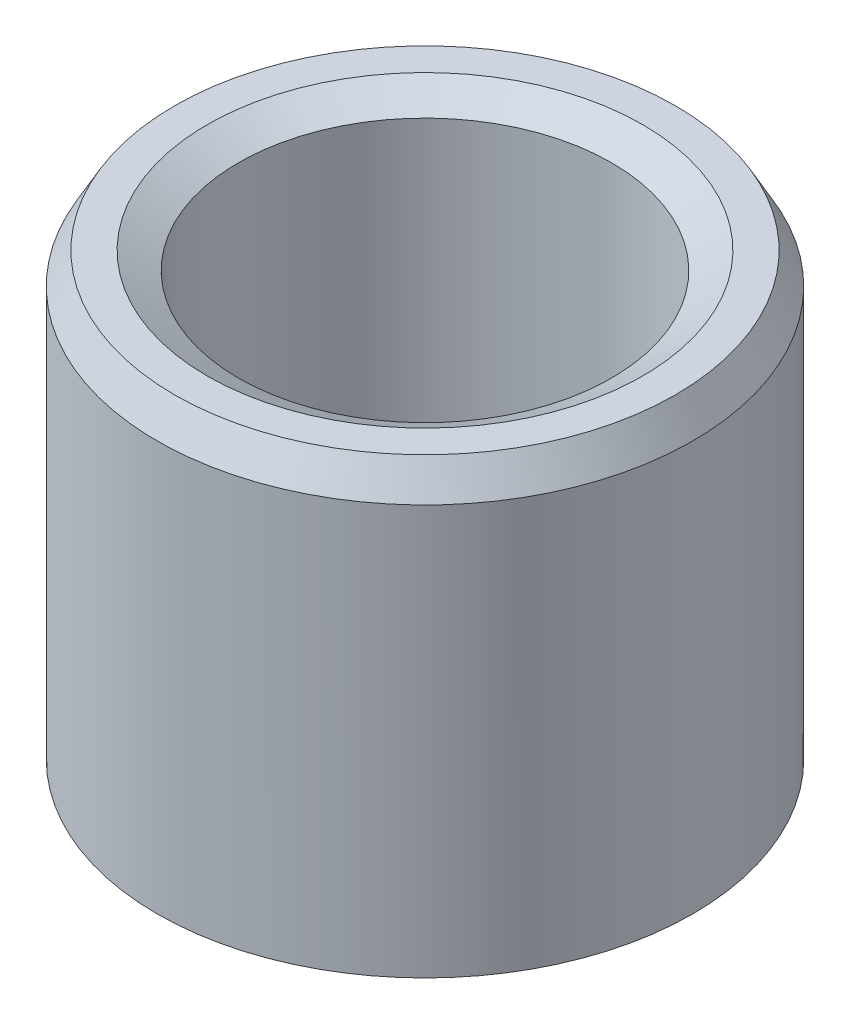
from build123d import *
from OCP.BRepFilletAPI import BRepFilletAPI_MakeChamfer

# Parameters (mm, degrees)
SKETCH1_R           = 27.5
BOSS_EXTRUDE1_DEPTH = 47.05147305
SKETCH2_R           = 19.156299915
CUT_EXTRUDE1_DEPTH  = 62.043763942
CHAMFER1_SIZE       = 3.201791099
CHAMFER1_SIZE2      = 1.786040665


with BuildPart() as part:
    # Sketch1 → Boss-Extrude1 (new body)
    with BuildSketch(Plane(origin=(0, 0, 0), x_dir=(1, 0, 0), z_dir=(0, 1, 0))):
        Circle(SKETCH1_R)
    extrude(amount=BOSS_EXTRUDE1_DEPTH)

    # Sketch2 → Cut-Extrude1 (cut, through all)
    with BuildSketch(Plane(origin=(0, 0, 0), x_dir=(1, 0, 0), z_dir=(0, 1, 0))):
        Circle(SKETCH2_R)
    extrude(amount=CUT_EXTRUDE1_DEPTH, mode=Mode.SUBTRACT)

    # Chamfer1: one chamfer whose edges measure the first distance from different faces: ONE call of the kernel's chamfer builder (chamfer() names one face for all edges)
    chamfer1_edges_1 = [part.edges().sort_by_distance(p)[0] for p in [
        (-19.156299915, 47.05147305, 0),
    ]]
    chamfer1_side_1 = [part.faces().sort_by_distance(p)[0] for p in [
        (-26.722182541, 47.05147305, 0),
    ]]
    chamfer1_edges_2 = [part.edges().sort_by_distance(p)[0] for p in [
        (-19.156299915, 0, 0),
    ]]
    chamfer1_side_2 = [part.faces().sort_by_distance(p)[0] for p in [
        (-19.156299915, 23.525736525, 0),
    ]]
    chamfer1_edges_3 = [part.edges().sort_by_distance(p)[0] for p in [
        (-27.5, 0, 0),
    ]]
    chamfer1_side_3 = [part.faces().sort_by_distance(p)[0] for p in [
        (-26.722182541, 0, 0),
    ]]
    chamfer1_edges_4 = [part.edges().sort_by_distance(p)[0] for p in [
        (-27.5, 47.05147305, 0),
    ]]
    chamfer1_side_4 = [part.faces().sort_by_distance(p)[0] for p in [
        (-27.5, 23.525736525, 0),
    ]]
    chamfer1 = BRepFilletAPI_MakeChamfer(part.part.solid().wrapped)
    for e in chamfer1_edges_1:
        chamfer1.Add(CHAMFER1_SIZE, CHAMFER1_SIZE2, e.wrapped, chamfer1_side_1[0].wrapped)  # the first distance lies on this face
    for e in chamfer1_edges_2:
        chamfer1.Add(CHAMFER1_SIZE, CHAMFER1_SIZE2, e.wrapped, chamfer1_side_2[0].wrapped)  # the first distance lies on this face
    for e in chamfer1_edges_3:
        chamfer1.Add(CHAMFER1_SIZE, CHAMFER1_SIZE2, e.wrapped, chamfer1_side_3[0].wrapped)  # the first distance lies on this face
    for e in chamfer1_edges_4:
        chamfer1.Add(CHAMFER1_SIZE, CHAMFER1_SIZE2, e.wrapped, chamfer1_side_4[0].wrapped)  # the first distance lies on this face
    add(Compound.cast(chamfer1.Shape()), mode=Mode.REPLACE)


solid = part.part
